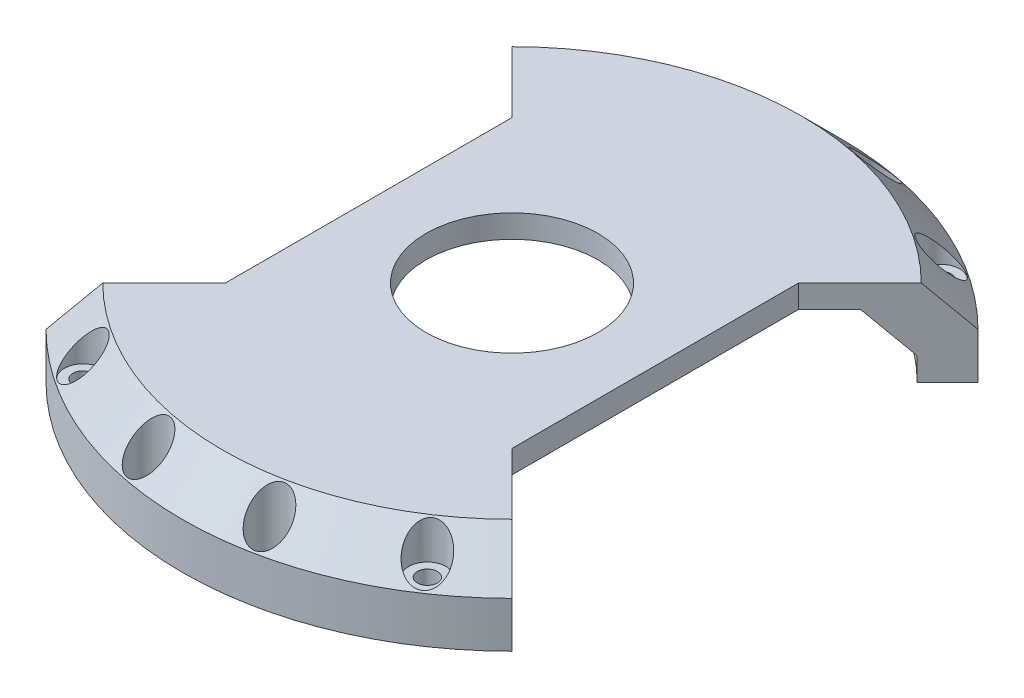
from build123d import *

# Parameters (mm, degrees)
SKETCH1_R           = 57.5
BOSS_EXTRUDE1_DEPTH = 15
SKETCH2_R           = 50
CUT_EXTRUDE1_DEPTH  = 11
SKETCH3_R           = 15
SKETCH3_R_2         = 1.75
CUT_EXTRUDE2_DEPTH  = 15
CUT_EXTRUDE3_START  = -15
CUT_EXTRUDE3_DEPTH  = 15
CHAMFER1_SIZE       = 7
SKETCH5_R           = 3.25
CUT_EXTRUDE4_DEPTH  = 7
SKETCH6_R           = 3.25
CUT_EXTRUDE5_DEPTH  = 55


with BuildPart() as part:
    # Sketch1 → Boss-Extrude1 (new body)
    with BuildSketch(Plane(origin=(0, 0, 0), x_dir=(1, 0, 0), z_dir=(0, 1, 0))):
        with Locations(Location((0, 0, 0), (0, 0, 270))):
            Circle(SKETCH1_R)
    extrude(amount=BOSS_EXTRUDE1_DEPTH)

    # Sketch2 → Cut-Extrude1 (cut)
    with BuildSketch(Plane.XZ):
        with Locations(Location((0, 0, 0), (0, 0, 270))):
            Circle(SKETCH2_R)
    extrude(amount=-CUT_EXTRUDE1_DEPTH, mode=Mode.SUBTRACT)

    # Sketch3 → Cut-Extrude2 (cut)
    with BuildSketch(Plane(origin=(0, 15, 0), x_dir=(1, 0, 0), z_dir=(0, 1, 0))):
        with Locations(Location((0, 0, 0), (0, 0, 270))):
            Circle(SKETCH3_R)
        with Locations(Location((-10.627298131, 52.943937655, 0), (0, 0, 270))):
            Circle(SKETCH3_R_2)
        with Locations(Location((10.442424555, 52.980711296, 0), (0, 0, 270))):
            Circle(SKETCH3_R_2)
        with Locations(Location((29.922382764, 44.951651913, 0), (0, 0, 270))):
            Circle(SKETCH3_R_2)
        with Locations(Location((44.846929444, 30.079111014, 0), (0, 0, 270))):
            Circle(SKETCH3_R_2)
        with Locations(Location((52.943937655, 10.627298131, 0), (0, 0, 270))):
            Circle(SKETCH3_R_2)
        with Locations(Location((52.980711296, -10.442424555, 0), (0, 0, 270))):
            Circle(SKETCH3_R_2)
        with Locations(Location((44.951651913, -29.922382764, 0), (0, 0, 270))):
            Circle(SKETCH3_R_2)
        with Locations(Location((30.079111014, -44.846929444, 0), (0, 0, 270))):
            Circle(SKETCH3_R_2)
        with Locations(Location((10.627298131, -52.943937655, 0), (0, 0, 270))):
            Circle(SKETCH3_R_2)
        with Locations(Location((-10.442424555, -52.980711296, 0), (0, 0, 270))):
            Circle(SKETCH3_R_2)
        with Locations(Location((-29.922382764, -44.951651913, 0), (0, 0, 270))):
            Circle(SKETCH3_R_2)
        with Locations(Location((-44.846929444, -30.079111014, 0), (0, 0, 270))):
            Circle(SKETCH3_R_2)
        with Locations(Location((-52.943937655, -10.627298131, 0), (0, 0, 270))):
            Circle(SKETCH3_R_2)
        with Locations(Location((-52.980711296, 10.442424555, 0), (0, 0, 270))):
            Circle(SKETCH3_R_2)
        with Locations(Location((-44.951651913, 29.922382764, 0), (0, 0, 270))):
            Circle(SKETCH3_R_2)
        with Locations(Location((-30.079111014, 44.846929444, 0), (0, 0, 270))):
            Circle(SKETCH3_R_2)
    extrude(amount=-CUT_EXTRUDE2_DEPTH, mode=Mode.SUBTRACT)

    # Sketch4 → Cut-Extrude3 (cut)
    with BuildSketch(Plane(origin=(0, 15, 0), x_dir=(1, 0, 0), z_dir=(0, 1, 0)).offset(CUT_EXTRUDE3_START)):
        with BuildLine():
            Line((25, 25), (40.658639918, 40.658639918))
            ThreePointArc((40.658639918, 40.658639918), (57.5, 0), (40.658639918, -40.658639918))
            Line((40.658639918, -40.658639918), (25, -25))
            Line((25, -25), (25, 25))
        make_face()
    cut_extrude3 = extrude(amount=CUT_EXTRUDE3_DEPTH, mode=Mode.SUBTRACT)

    # Mirror1: Cut-Extrude3 across plane
    add(cut_extrude3.mirror(Plane(origin=(0, 0, 0), x_dir=(0, 0, 1), z_dir=(1, 0, 0))), mode=Mode.SUBTRACT)

    # Chamfer1
    # the kernel refuses this chamfer: 7 mm, written as the material it adds along each edge
    with BuildSketch(Plane(origin=(0, 11, 0), x_dir=(0.7071067811865475, 0, -0.7071067811865477), z_dir=(0.7071067811865477, 0, 0.7071067811865475))) as chamfer1_piece_1:
        Polygon((50, -CHAMFER1_SIZE), (50 - CHAMFER1_SIZE, 0), (50, 0), align=None)
    revolve(axis=Axis((0, 11, 0), (0, 1, 0)), revolution_arc=90)
    with BuildSketch(Plane(origin=(0, 11, 0), x_dir=(-0.7071067811865476, 0, 0.7071067811865476), z_dir=(-0.7071067811865476, 0, -0.7071067811865476))) as chamfer1_piece_2:
        Polygon((50 - CHAMFER1_SIZE, 0), (50, -CHAMFER1_SIZE), (50, 0), align=None)
    revolve(axis=Axis((0, 11, 0), (0, 1, 0)), revolution_arc=90)
    # the kernel refuses this chamfer: 7 mm, written as the material it takes off along each edge
    with BuildSketch(Plane(origin=(0, 15, 0), x_dir=(0.890570714861766, 0, 0.4548448107108656), z_dir=(0.4548448107108656, 0, -0.890570714861766))) as chamfer1_2_piece_1:
        Polygon((57.5 - CHAMFER1_SIZE, 0), (57.5, CHAMFER1_SIZE), (57.5, 0), align=None)
    revolve(axis=Axis((0, 15, 0), (0, -1, 0)), revolution_arc=125.890100955, mode=Mode.SUBTRACT)
    with BuildSketch(Plane(origin=(0, 15, 0), x_dir=(-0.890570714861766, 0, -0.4548448107108656), z_dir=(-0.4548448107108656, 0, 0.890570714861766))) as chamfer1_2_piece_2:
        Polygon((57.5, CHAMFER1_SIZE), (57.5 - CHAMFER1_SIZE, 0), (57.5, 0), align=None)
    revolve(axis=Axis((0, 15, 0), (0, -1, 0)), revolution_arc=125.890100955, mode=Mode.SUBTRACT)

    # Sketch5 → Cut-Extrude4 (cut)
    with BuildSketch(Plane(origin=(0, 15, 0), x_dir=(1, 0, 0), z_dir=(0, 1, 0))):
        with Locations(Location((-10.627298131, 52.943937655, 0), (0, 0, 270))):
            Circle(SKETCH5_R)
        with Locations(Location((10.442424555, 52.980711296, 0), (0, 0, 270))):
            Circle(SKETCH5_R)
        with Locations(Location((29.922382764, 44.951651913, 0), (0, 0, 270))):
            Circle(SKETCH5_R)
        with Locations((44.846929444, 30.079111014)):
            Circle(SKETCH5_R)
        with Locations((52.943937655, 10.627298131)):
            Circle(SKETCH5_R)
        with Locations((52.980711296, -10.442424555)):
            Circle(SKETCH5_R)
        with Locations((44.951651913, -29.922382764)):
            Circle(SKETCH5_R)
        with Locations(Location((30.079111014, -44.846929444, 0), (0, 0, 270))):
            Circle(SKETCH5_R)
        with Locations(Location((10.627298131, -52.943937655, 0), (0, 0, 270))):
            Circle(SKETCH5_R)
        with Locations(Location((-10.442424555, -52.980711296, 0), (0, 0, 270))):
            Circle(SKETCH5_R)
        with Locations(Location((-29.922382764, -44.951651913, 0), (0, 0, 270))):
            Circle(SKETCH5_R)
        with Locations((-44.846929444, -30.079111014)):
            Circle(SKETCH5_R)
        with Locations((-52.943937655, -10.627298131)):
            Circle(SKETCH5_R)
        with Locations((-52.980711296, 10.442424555)):
            Circle(SKETCH5_R)
        with Locations((-44.951651913, 29.922382764)):
            Circle(SKETCH5_R)
        with Locations(Location((-30.079111014, 44.846929444, 0), (0, 0, 270))):
            Circle(SKETCH5_R)
    extrude(amount=-CUT_EXTRUDE4_DEPTH, mode=Mode.SUBTRACT)

    # Sketch6 → Cut-Extrude5 (cut)
    with BuildSketch(Plane(origin=(0, 15, 0), x_dir=(1, 0, 0), z_dir=(0, 1, 0))):
        with Locations(Location((-10.627298131, 52.943937655, 0), (0, 0, 270))):
            Circle(SKETCH6_R)
        with Locations(Location((10.442424555, 52.980711296, 0), (0, 0, 270))):
            Circle(SKETCH6_R)
        with Locations(Location((-10.442424555, -52.980711296, 0), (0, 0, 270))):
            Circle(SKETCH6_R)
        with Locations(Location((10.627298131, -52.943937655, 0), (0, 0, 270))):
            Circle(SKETCH6_R)
    extrude(amount=-CUT_EXTRUDE5_DEPTH, mode=Mode.SUBTRACT)


solid = part.part
